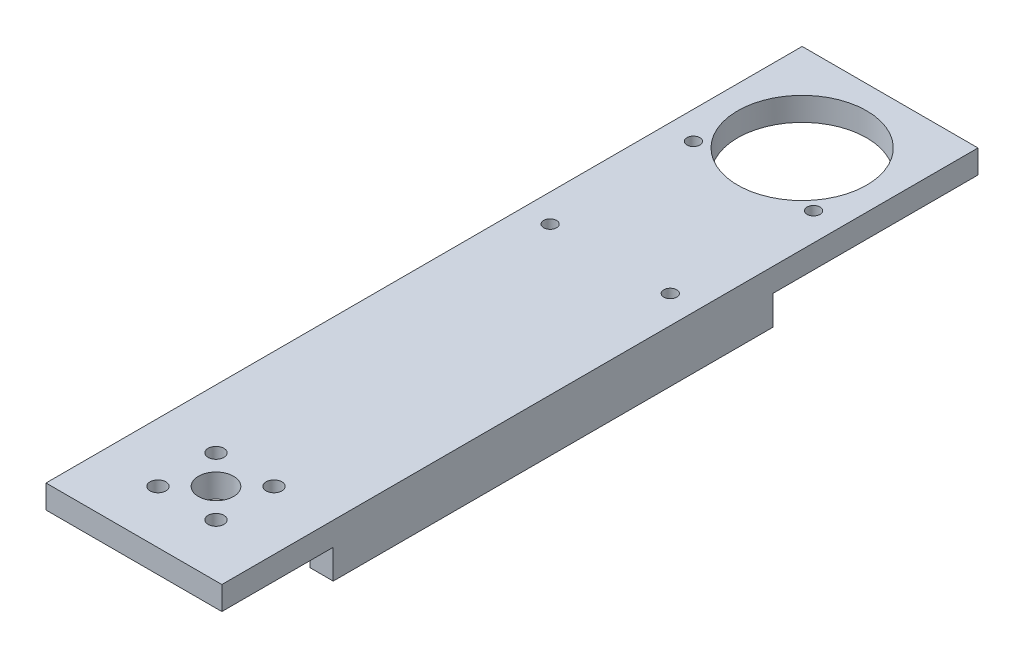
from build123d import *

# Parameters (mm, degrees)
S_BOX1_W      = 30
S_BOX1_H      = 4
BOSS_1_DEPTH  = 129
S_BOX2_W      = 4
S_BOX2_H      = 5.5
BOSS_2_DEPTH  = 75
S_BOX3_W      = 4
S_BOX3_H      = 5.5
BOSS_3_DEPTH  = 75
S_HOLE4_R     = 3
HOLE_4_DEPTH  = 4.2
S_HOLE5_R     = 1.35
HOLE_5_DEPTH  = 4.2
S_HOLE6_R     = 1.35
HOLE_6_DEPTH  = 4.2
S_HOLE7_R     = 1.35
HOLE_7_DEPTH  = 4.2
S_HOLE8_R     = 1.35
HOLE_8_DEPTH  = 4.2
S_HOLE9_R     = 11
HOLE_9_DEPTH  = 4.2
S_HOLE10_R    = 1.1
HOLE_10_DEPTH = 4.2
S_HOLE11_R    = 1.1
HOLE_11_DEPTH = 4.2
S_HOLE12_R    = 1.1
HOLE_12_DEPTH = 4.2
S_HOLE13_R    = 1.1
HOLE_13_DEPTH = 4.2


with BuildPart() as part:
    # S_box1 → Boss_1 (new body)
    with BuildSketch(Plane.XY.offset(-115)):
        with Locations((0, -20.625)):
            Rectangle(S_BOX1_W, S_BOX1_H)
    extrude(amount=BOSS_1_DEPTH)

    # S_box2 → Boss_2 (add)
    with BuildSketch(Plane.XY.offset(-80)):
        with Locations((-13, -24.875)):
            Rectangle(S_BOX2_W, S_BOX2_H)
    extrude(amount=BOSS_2_DEPTH)

    # S_box3 → Boss_3 (add)
    with BuildSketch(Plane.XY.offset(-80)):
        with Locations((13, -24.875)):
            Rectangle(S_BOX3_W, S_BOX3_H)
    extrude(amount=BOSS_3_DEPTH)

    # S_hole4 → Hole_4 (cut)
    with BuildSketch(Plane(origin=(0, -22.725, 0), x_dir=(1, 0, 0), z_dir=(0, 1, 0))):
        Circle(S_HOLE4_R)
    extrude(amount=HOLE_4_DEPTH, mode=Mode.SUBTRACT)

    # S_hole5 → Hole_5 (cut)
    with BuildSketch(Plane(origin=(0, -22.725, 0), x_dir=(1, 0, 0), z_dir=(0, 1, 0))):
        with Locations((4.949747468, -4.949747468)):
            Circle(S_HOLE5_R)
    extrude(amount=HOLE_5_DEPTH, mode=Mode.SUBTRACT)

    # S_hole6 → Hole_6 (cut)
    with BuildSketch(Plane(origin=(0, -22.725, 0), x_dir=(1, 0, 0), z_dir=(0, 1, 0))):
        with Locations((-4.949747468, -4.949747468)):
            Circle(S_HOLE6_R)
    extrude(amount=HOLE_6_DEPTH, mode=Mode.SUBTRACT)

    # S_hole7 → Hole_7 (cut)
    with BuildSketch(Plane(origin=(0, -22.725, 0), x_dir=(1, 0, 0), z_dir=(0, 1, 0))):
        with Locations((-4.949747468, 4.949747468)):
            Circle(S_HOLE7_R)
    extrude(amount=HOLE_7_DEPTH, mode=Mode.SUBTRACT)

    # S_hole8 → Hole_8 (cut)
    with BuildSketch(Plane(origin=(0, -22.725, 0), x_dir=(1, 0, 0), z_dir=(0, 1, 0))):
        with Locations((4.949747468, 4.949747468)):
            Circle(S_HOLE8_R)
    extrude(amount=HOLE_8_DEPTH, mode=Mode.SUBTRACT)

    # S_hole9 → Hole_9 (cut)
    with BuildSketch(Plane(origin=(0, -22.725, 0), x_dir=(1, 0, 0), z_dir=(0, 1, 0))):
        with Locations((0, 100)):
            Circle(S_HOLE9_R)
    extrude(amount=HOLE_9_DEPTH, mode=Mode.SUBTRACT)

    # S_hole10 → Hole_10 (cut)
    with BuildSketch(Plane(origin=(0, -22.725, 0), x_dir=(1, 0, 0), z_dir=(0, 1, 0))):
        with Locations((-10.25, 91.7)):
            Circle(S_HOLE10_R)
    extrude(amount=HOLE_10_DEPTH, mode=Mode.SUBTRACT)

    # S_hole11 → Hole_11 (cut)
    with BuildSketch(Plane(origin=(0, -22.725, 0), x_dir=(1, 0, 0), z_dir=(0, 1, 0))):
        with Locations((10.25, 91.7)):
            Circle(S_HOLE11_R)
    extrude(amount=HOLE_11_DEPTH, mode=Mode.SUBTRACT)

    # S_hole12 → Hole_12 (cut)
    with BuildSketch(Plane(origin=(0, -22.725, 0), x_dir=(1, 0, 0), z_dir=(0, 1, 0))):
        with Locations((-10.25, 67.25)):
            Circle(S_HOLE12_R)
    extrude(amount=HOLE_12_DEPTH, mode=Mode.SUBTRACT)

    # S_hole13 → Hole_13 (cut)
    with BuildSketch(Plane(origin=(0, -22.725, 0), x_dir=(1, 0, 0), z_dir=(0, 1, 0))):
        with Locations((10.25, 67.25)):
            Circle(S_HOLE13_R)
    extrude(amount=HOLE_13_DEPTH, mode=Mode.SUBTRACT)


solid = part.part
